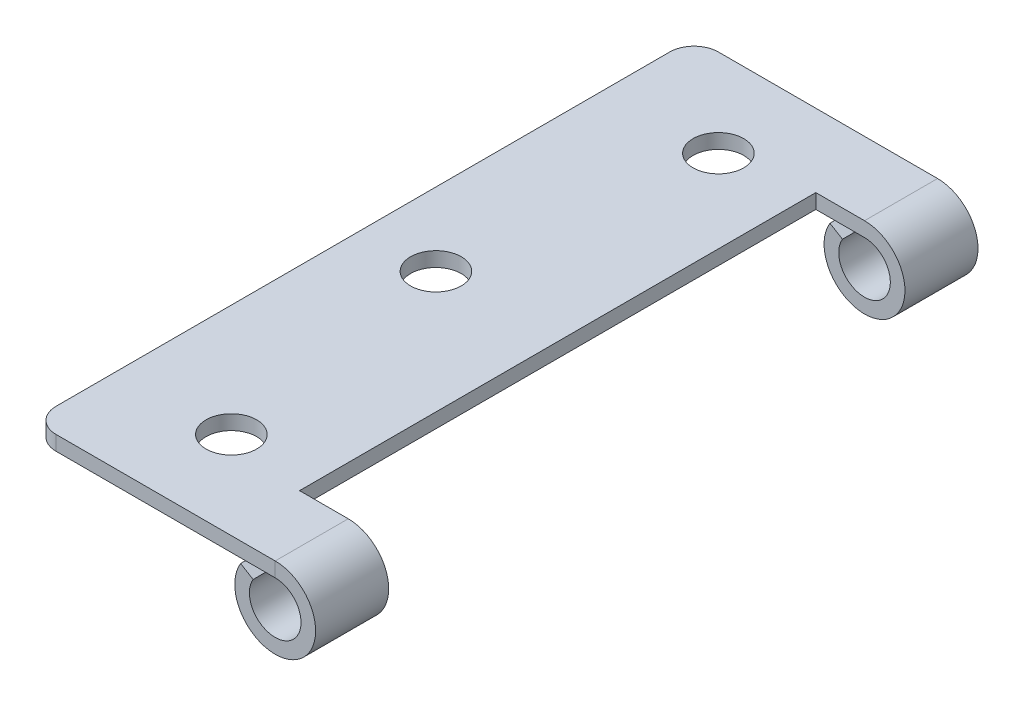
from build123d import *

# Parameters (mm, degrees)
TABAN_FLAN_1_DEPTH    = 34
IZIM9_W               = 9.15
IZIM9_H               = 53
KES_EKSTR_ZYON1_DEPTH = 39.757096124
IZIM11_R              = 2.6
KES_EKSTR_ZYON2_DEPTH = 10
RADYUS1_R             = 2.5


# Sheet-metal steps are written as plain solids
with BuildPart() as part:
    # Çizim1 → Taban-Flanş1 (new, symmetric)
    with BuildSketch(Plane.XY):
        with BuildLine():
            Line((-12.5, 0), (12.5, 0))
            ThreePointArc((12.5, 0), (14.537154879, -7.765591238), (8.95035213, -2))
            Line((8.95035213, -2), (10.233357384, -2.777108434))
            ThreePointArc((10.233357384, -2.777108434), (13.800833838, -6.458751031), (12.5, -1.5))
            Line((12.5, -1.5), (-12.5, -1.5))
            Line((-12.5, -1.5), (-12.5, 0))
        make_face()
    extrude(amount=TABAN_FLAN_1_DEPTH, both=True)

    # Çizim9 → Kes-Ekstrüzyon1 (cut, through all)
    with BuildSketch(Plane(origin=(0, 0, 0), x_dir=(1, 0, 0), z_dir=(0, 1, 0))):
        with Locations((12.075, 0)):
            Rectangle(IZIM9_W, IZIM9_H)
    extrude(amount=-KES_EKSTR_ZYON1_DEPTH, mode=Mode.SUBTRACT)

    # Çizim11 → Kes-Ekstrüzyon2 (cut)
    with BuildSketch(Plane(origin=(0, 0, 0), x_dir=(1, 0, 0), z_dir=(0, 1, 0))):
        with Locations(Location((-1, 25, 0), (0, 0, 180))):
            Circle(IZIM11_R)
        with Locations(Location((-1, -25, 0), (0, 0, 180))):
            Circle(IZIM11_R)
        with Locations(Location((-5, 0, 0), (0, 0, 180))):
            Circle(IZIM11_R)
    extrude(amount=-KES_EKSTR_ZYON2_DEPTH, mode=Mode.SUBTRACT)

    # Radyus1
    radyus1_edges = [part.edges().sort_by_distance(p)[0] for p in [
        (-12.5, -0.75, 34),
        (-12.5, -0.75, -34),
    ]]
    fillet(radyus1_edges, radius=RADYUS1_R)


solid = part.part
